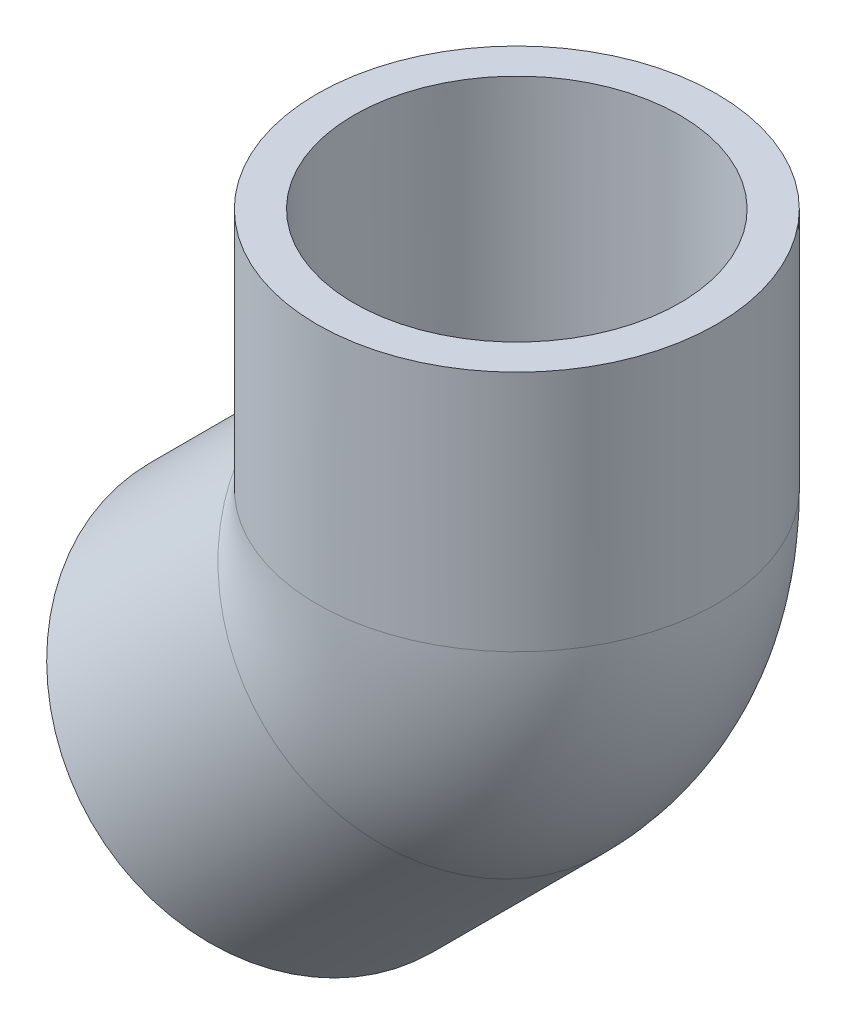
from build123d import *

# Parameters (mm, degrees)
SWEEP1_OUTLINE_R = 13.3223
SWEEP1_ANGLE     = 45


# Read off the part's stored shape, not the designer's step: Sweep1
with BuildPart() as part:
    # Sketch1 → Revolve1 (revolve)
    with BuildSketch(Plane.XY):
        Polygon((-8.701868181, -37.887700575), (8.989236377, -20.196596016), (6.160455699, -17.367815338), (-11.395945018, -35.193623738), align=None)
    revolve(axis=Axis((-23.294784378, -23.294784378, 0), (0.7071067811865488, 0.7071067811865464, 0)))



with BuildPart() as body_2:
    # Sketch2 → Revolve2 (revolve)
    with BuildSketch(Plane.XY, mode=Mode.PRIVATE) as revolve2_sk:
        Polygon((16.8275, 32.9438), (16.637, 7.9248), (20.6375, 7.9248), (20.6375, 32.9438), align=None)
    revolve(revolve2_sk.sketch.rotate(Axis((0, 0, 0), (0, 1, 0)), 90), axis=Axis((0, 0, 0), (0, 1, 0)))


with BuildPart() as part_1:
    add(part.part)

    add(body_2.part)  # Sweep1 merges body 2
    # Sweep1 outline → Sweep1 (revolve)
    with BuildSketch(Plane(origin=(-19.132159639, 7.9248, 0), x_dir=(0.7071067811865458, -0.7071067811865492, 0), z_dir=(-0.7071067811865492, -0.7071067811865458, 0))):
        with BuildLine():
            add(Edge.make_bspline(
                [(0, -7.737368661), (1.564698521, -11.606392253), (4.329688418, -15.612144087), (8.599185244, -19.042775632), (14.028910899, -20.6375), (22.054286685, -20.6375), (24.908775845, -20.120136516), (27.504290511, -19.135341383), (29.749677614, -17.857364724), (34.25866107, -14.41749403), (36.733928168, -11.707892389), (38.755825272, -8.19450204), (40.77758572, 2.19e-07), (38.755825079, 8.194502376), (36.733928009, 11.707892562), (34.258660987, 14.417494094), (29.749677555, 17.857364769), (27.504290371, 19.135341463), (24.908775603, 20.120136608), (22.05428633, 20.637500064), (14.028910521, 20.637499888), (8.599185013, 19.04277545), (4.329688317, 15.61214394), (1.564698493, 11.606392184), (0, 7.737368661)],
                knots=[7.871585041, 7.871585041, 7.871585041, 7.871585041, 7.871585041, 7.871585041, 9.040469721, 9.040469721, 9.040469721, 9.040469721, 9.709774651, 9.709774651, 9.709774651, 9.709774651, 10.62886947, 10.62886947, 10.62886947, 11.54796426, 11.54796426, 11.54796426, 11.54796426, 12.21726921, 12.21726921, 12.21726921, 12.21726921, 13.38615387, 13.38615387, 13.38615387, 13.38615387, 13.38615387, 13.38615387], degree=5, weights=[1, 1, 0.993873067, 0.989146846, 1, 1, 0.999666967, 1.000111622, 1, 1, 0.99897335, 0.997077605, 1.002922395, 0.997077605, 0.99897335, 1, 1, 1.000111622, 0.999666967, 1, 1, 0.989146847, 0.993873067, 1, 1]))
            Line((0, 7.737368661), (0, -7.737368661))
        make_face()
        with Locations((19.132159639, 0)):
            Circle(SWEEP1_OUTLINE_R, mode=Mode.SUBTRACT)
    revolve(axis=Axis((-19.132159639, 7.9248, 0), (0, 0, 1)), revolution_arc=SWEEP1_ANGLE)


solid = part_1.part
